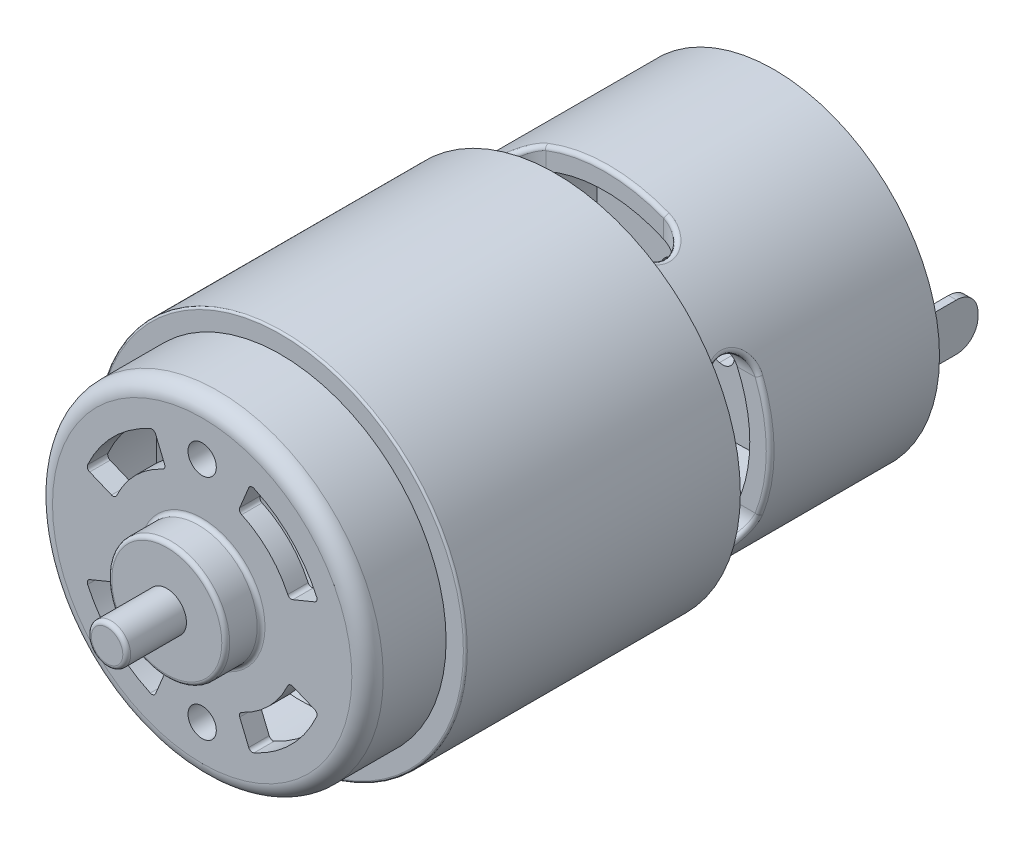
from build123d import *

# Parameters (mm, degrees)
SKETCH5_R                     = 21.05
MOTOR_BODY_DEPTH              = 71.3
SKETCH1_R                     = 23.5
FLUX_RING_DEPTH               = 35
SKETCH6_R                     = 7.5
FRONT_NUB_DEPTH               = 4.5
OUTPUT_SHAFT_DEPTH            = 12.1
OUTPUT_SHAFT_DEPTH_BACK       = 77.5
SKETCH3_R                     = 2.5
SKETCH16_R                    = 21.05
SKETCH16_R_2                  = 20.55
SHEET_METAL_CASING_EDGE_DEPTH = 1.5
SHELL1_START                  = -68.7
SHELL1_OUTLINE_R              = 18.45
SHELL1_DEPTH                  = 66.1
SHELL1_START_2                = -42.4
SHELL1_2_OUTLINE_R            = 20.9
SHELL1_2_OUTLINE_R_2          = 18.45
SHELL1_2_DEPTH                = 29.8
SHELL1_START_3                = -2.6
SHELL1_3_OUTLINE_R            = 4.9
SHELL1_3_DEPTH                = 4.5
M4_MOUNT_HOLES_REACH          = 86.325
SKETCH7_R                     = 1.8
CIRPATTERN1_COUNT             = 2
SIDE_VENT_HOLES_DEPTH         = 85.325263118
CIRPATTERN2_COUNT             = 4
FRONT_VENT_HOLES_REACH        = 86.325
CIRPATTERN3_COUNT             = 4
REAR_NUB_START                = 4.5
SKETCH10_R                    = 7.5
REAR_NUB_DEPTH                = 4.5
SKETCH11_R                    = 6.5
REAR_FLAIR_DEPTH              = 1
REAR_VENT_HOLES_REACH         = 91.778
MIRROR2_COPY_1_REACH          = 91.778
FILLET1_R                     = 0.5
FILLET3_R                     = 0.5
FILLET4_R                     = 2
FILLET5_R                     = 0.5
FILLET6_R                     = 0.25
SKETCH14_W                    = 4
SKETCH14_H                    = 10
PLASTIC_TERMINAL_BASE_DEPTH   = 1
SKETCH17_W                    = 1
SKETCH17_H                    = 6
BOSS_EXTRUDE14_DEPTH          = 7.5
FILLET7_R                     = 2.75


with BuildPart() as part:
    # Sketch5 → Motor_Body (new body)
    with BuildSketch(Plane.XY):
        Circle(SKETCH5_R)
    extrude(amount=-MOTOR_BODY_DEPTH)

    # Sketch1 → Flux_Ring (add)
    with BuildSketch(Plane.XY.offset(-10)):
        Circle(SKETCH1_R)
    extrude(amount=-FLUX_RING_DEPTH)

    # Sketch6 → Front_Nub (add)
    with BuildSketch(Plane.XY):
        Circle(SKETCH6_R)
    extrude(amount=FRONT_NUB_DEPTH)

    # Sketch3 → Output_Shaft (add, two sides: drawn at the far end of the back side and taken through both)
    with BuildSketch(Plane.XY.offset(-OUTPUT_SHAFT_DEPTH_BACK)):
        Circle(SKETCH3_R)
    extrude(amount=OUTPUT_SHAFT_DEPTH + OUTPUT_SHAFT_DEPTH_BACK)

    # Sketch16 → Sheet_Metal_Casing_Edge (add)
    with BuildSketch(Plane(origin=(0, 0, -71.3), x_dir=(-1, 0, 0), z_dir=(0, 0, -1))):
        with Locations(Location((0, 0, 0), (0, 0, 180))):
            Circle(SKETCH16_R)
        Circle(SKETCH16_R_2, mode=Mode.SUBTRACT)
    extrude(amount=SHEET_METAL_CASING_EDGE_DEPTH)

    # Shell1: read off the stored shape, not the designer's step
    # Shell1 outline → Shell1 (cut)
    with BuildSketch(Plane.XY.offset(SHELL1_START)):
        Circle(SHELL1_OUTLINE_R)
    extrude(amount=SHELL1_DEPTH, mode=Mode.SUBTRACT)

    # Shell1 2 outline → Shell1 2 (cut)
    with BuildSketch(Plane.XY.offset(SHELL1_START_2)):
        Circle(SHELL1_2_OUTLINE_R)
        Circle(SHELL1_2_OUTLINE_R_2, mode=Mode.SUBTRACT)
    extrude(amount=SHELL1_2_DEPTH, mode=Mode.SUBTRACT)

    # Shell1 3 outline → Shell1 3 (cut)
    with BuildSketch(Plane.XY.offset(SHELL1_START_3)):
        Circle(SHELL1_3_OUTLINE_R)
    extrude(amount=SHELL1_3_DEPTH, mode=Mode.SUBTRACT)

    # Sketch7 → m4_Mount_Holes (cut, up to next)
    with BuildSketch(Plane.XY, mode=Mode.PRIVATE) as m4_mount_holes_sk1:
        with Locations((0, 14.5)):
            Circle(SKETCH7_R)
    m4_mount_holes_tool1 = extrude(m4_mount_holes_sk1.sketch, amount=-M4_MOUNT_HOLES_REACH, mode=Mode.PRIVATE) & part.part
    m4_mount_holes = m4_mount_holes_tool1.solids().sort_by_distance((0, 14.5, 0))[0]
    add(m4_mount_holes, mode=Mode.SUBTRACT)

    # CirPattern1: m4_Mount_Holes ×2 about axis
    cirpattern1_axis = Axis((0, 0, 0), (0, 0, 1))
    for i in range(1, CIRPATTERN1_COUNT):
        add(m4_mount_holes.rotate(cirpattern1_axis, i * 360 / CIRPATTERN1_COUNT), mode=Mode.SUBTRACT)

    # Sketch8 → Side_Vent_Holes (cut, through all)
    with BuildSketch(Plane(origin=(0, 0, 0), x_dir=(1, 0, 0), z_dir=(0, 1, 0))):
        with BuildLine():
            Line((-7.5, 51.25), (7.5, 51.25))
            ThreePointArc((7.5, 51.25), (10.5, 48.25), (7.5, 45.25))
            Line((7.5, 45.25), (-7.5, 45.25))
            ThreePointArc((-7.5, 45.25), (-10.5, 48.25), (-7.5, 51.25))
        make_face()
    side_vent_holes = extrude(amount=SIDE_VENT_HOLES_DEPTH, mode=Mode.SUBTRACT)

    # CirPattern2: Side_Vent_Holes ×4 about axis
    cirpattern2_axis = Axis((0, 0, -92.225153379), (0, 0, 1))
    for i in range(1, CIRPATTERN2_COUNT):
        add(side_vent_holes.rotate(cirpattern2_axis, i * 360 / CIRPATTERN2_COUNT), mode=Mode.SUBTRACT)

    # Sketch9 → Front_Vent_Holes (cut, up to next)
    with BuildSketch(Plane.XY, mode=Mode.PRIVATE) as front_vent_holes_sk1:
        with BuildLine():
            Line((-4.592201188, 11.08655439), (-6.122934918, 14.78207252))
            ThreePointArc((-6.122934918, 14.78207252), (-11.313708499, 11.313708499), (-14.78207252, 6.122934918))
            Line((-14.78207252, 6.122934918), (-11.08655439, 4.592201188))
            ThreePointArc((-11.08655439, 4.592201188), (-8.485281374, 8.485281374), (-4.592201188, 11.08655439))
        make_face()
    front_vent_holes_tool1 = extrude(front_vent_holes_sk1.sketch, amount=-FRONT_VENT_HOLES_REACH, mode=Mode.PRIVATE) & part.part
    front_vent_holes = front_vent_holes_tool1.solids().sort_by_distance((-9.712638, 9.712638, 0))[0]
    add(front_vent_holes, mode=Mode.SUBTRACT)

    # CirPattern3: Front_Vent_Holes ×4 about axis
    cirpattern3_axis = Axis((0, 0, -92.225153379), (0, 0, 1))
    for i in range(1, CIRPATTERN3_COUNT):
        add(front_vent_holes.rotate(cirpattern3_axis, i * 360 / CIRPATTERN3_COUNT), mode=Mode.SUBTRACT)

    # Sketch10 → Rear_Nub (add)
    with BuildSketch(Plane(origin=(0, 0, -71.3), x_dir=(-1, 0, 0), z_dir=(0, 0, -1)).offset(REAR_NUB_START)):
        with Locations(Location((0, 0, 0), (0, 0, 180))):
            Circle(SKETCH10_R)
    extrude(amount=-REAR_NUB_DEPTH)

    # Sketch11 → Rear_Flair (add)
    with BuildSketch(Plane(origin=(0, 0, -75.8), x_dir=(-1, 0, 0), z_dir=(0, 0, -1))):
        Circle(SKETCH11_R)
    extrude(amount=REAR_FLAIR_DEPTH)

    # Sketch13 → Rear_Vent_Holes (cut, up to next)
    with BuildSketch(Plane(origin=(0, 0, -71.3), x_dir=(-1, 0, 0), z_dir=(0, 0, -1)), mode=Mode.PRIVATE) as rear_vent_holes_sk1:
        with BuildLine():
            ThreePointArc((-2.070552361, 7.72740661), (-5.274766521, 6.01471846), (-7.39103626, 3.061467459))
            ThreePointArc((-7.39103626, 3.061467459), (-9.350880707, 2.249673309), (-10.162674858, 4.209517756))
            ThreePointArc((-10.162674858, 4.209517756), (-7.252803966, 8.270237882), (-2.847009496, 10.625184089))
            ThreePointArc((-2.847009496, 10.625184089), (-1.009892189, 9.564523917), (-2.070552361, 7.72740661))
        make_face()
    rear_vent_holes_tool1 = extrude(rear_vent_holes_sk1.sketch, amount=-REAR_VENT_HOLES_REACH, mode=Mode.PRIVATE) & part.part
    rear_vent_holes = rear_vent_holes_tool1.solids().sort_by_distance((5.955533, 6.790984, -71.3))[0]
    add(rear_vent_holes, mode=Mode.SUBTRACT)

    # Mirror1: Rear_Vent_Holes across plane
    add(rear_vent_holes.mirror(Plane(origin=(0, 0, 0), x_dir=(0, 0, 1), z_dir=(1, 0, 0))), mode=Mode.SUBTRACT)

    # Mirror2: Rear_Vent_Holes across plane
    add(rear_vent_holes.mirror(Plane.ZX), mode=Mode.SUBTRACT)

    # Mirror2 copy 1 sketch → Mirror2 copy 1 (cut, up to next)
    with BuildSketch(Plane(origin=(0, 0, -71.3), x_dir=(1, 0, 0), z_dir=(0, 0, -1)), mode=Mode.PRIVATE) as mirror2_copy_1_sk1:
        with BuildLine():
            ThreePointArc((-2.070552361, 7.72740661), (-5.274766521, 6.01471846), (-7.39103626, 3.061467459))
            ThreePointArc((-7.39103626, 3.061467459), (-9.350880707, 2.249673309), (-10.162674858, 4.209517756))
            ThreePointArc((-10.162674858, 4.209517756), (-7.252803966, 8.270237882), (-2.847009496, 10.625184089))
            ThreePointArc((-2.847009496, 10.625184089), (-1.009892189, 9.564523917), (-2.070552361, 7.72740661))
        make_face()
    mirror2_copy_1_tool1 = extrude(mirror2_copy_1_sk1.sketch, amount=-MIRROR2_COPY_1_REACH, mode=Mode.PRIVATE) & part.part
    add(mirror2_copy_1_tool1.solids().sort_by_distance((-5.955533, -6.790984, -71.3))[0], mode=Mode.SUBTRACT)

    # Fillet1
    fillet1_edges = [part.edges().sort_by_distance(p)[0] for p in [
        (-4.592201188, 11.08655439, -1.3),
        (-11.08655439, 4.592201188, -1.3),
        (-14.78207252, 6.122934918, -1.3),
        (-6.122934918, 14.78207252, -1.3),
        (-11.08655439, -4.592201188, -1.3),
        (-4.592201188, -11.08655439, -1.3),
        (-6.122934918, -14.78207252, -1.3),
        (-14.78207252, -6.122934918, -1.3),
        (4.592201188, -11.08655439, -1.3),
        (11.08655439, -4.592201188, -1.3),
        (14.78207252, -6.122934918, -1.3),
        (6.122934918, -14.78207252, -1.3),
        (11.08655439, 4.592201188, -1.3),
        (4.592201188, 11.08655439, -1.3),
        (6.122934918, 14.78207252, -1.3),
        (14.78207252, 6.122934918, -1.3),
    ]]
    fillet(fillet1_edges, radius=FILLET1_R)

    # Fillet2: read off the stored shape, not the designer's step
    # Fillet2 outline → Fillet2 (revolve, cut)
    with BuildSketch(Plane.XZ):
        with BuildLine():
            Line((7.5, -76.8), (7.5, -75.3))
            ThreePointArc((7.5, -75.3), (7.353553391, -75.653553391), (7, -75.8))
            Line((7, -75.8), (7, -76.8))
            Line((7, -76.8), (7.5, -76.8))
        make_face()
        with BuildLine():
            ThreePointArc((7, 4.5), (7.353553391, 4.353553391), (7.5, 4))
            Line((7.5, 4), (7.5, 4.5))
            Line((7.5, 4.5), (7, 4.5))
        make_face()
    revolve(axis=Axis((0, 0, 0), (0, 0, 1)), mode=Mode.SUBTRACT)

    # Fillet2 2 outline → Fillet2 2 (revolve)
    with BuildSketch(Plane.XZ):
        with BuildLine():
            ThreePointArc((7.5, -71.8), (7.646446609, -71.446446609), (8, -71.3))
            Line((8, -71.3), (7.5, -71.3))
            Line((7.5, -71.3), (7.5, -71.8))
        make_face()
        with BuildLine():
            Line((7.5, 0), (8, 0))
            ThreePointArc((8, 0), (7.646446609, 0.146446609), (7.5, 0.5))
            Line((7.5, 0.5), (7.5, 0))
        make_face()
        with BuildLine():
            Line((7, -75.8), (7, -75.3))
            Line((7, -75.3), (6, -75.3))
            Line((6, -75.3), (6, -76.8))
            ThreePointArc((6, -76.8), (6.353553391, -76.653553391), (6.5, -76.3))
            ThreePointArc((6.5, -76.3), (6.646446609, -75.946446609), (7, -75.8))
        make_face()
    revolve(axis=Axis((0, 0, 0), (0, 0, 1)))

    # Fillet2 3 outline → Fillet2 3 (revolve, cut)
    with BuildSketch(Plane.XZ):
        with BuildLine():
            Line((6.5, -76.8), (6.5, -76.3))
            ThreePointArc((6.5, -76.3), (6.353553391, -76.653553391), (6, -76.8))
            Line((6, -76.8), (6.5, -76.8))
        make_face()
    revolve(axis=Axis((0, 0, 0), (0, 0, 1)), mode=Mode.SUBTRACT)

    # Fillet3
    fillet3_edges = [part.edges().sort_by_distance(p)[0] for p in [
        (-2.5, 0, -77.5),
        (-2.5, 0, 12.1),
    ]]
    fillet(fillet3_edges, radius=FILLET3_R)

    # Fillet4
    fillet4_edges = [part.edges().sort_by_distance(p)[0] for p in [
        (-21.05, 0, 0),
    ]]
    fillet(fillet4_edges, radius=FILLET4_R)

    # Fillet5
    fillet5_edges = [part.edges().sort_by_distance(p)[0] for p in [
        (0, 21.05, -51.25),
        (20.701761042, 3.813081401, -51.25),
        (20.701761042, 3.813081401, -51.25),
        (0, -21.05, -51.25),
        (-21.05, 0, -51.25),
    ]]
    fillet(fillet5_edges, radius=FILLET5_R)

    # Fillet6
    fillet6_edges = [part.edges().sort_by_distance(p)[0] for p in [
        (-23.5, 0, -10),
    ]]
    fillet(fillet6_edges, radius=FILLET6_R)

    # Sketch14 → Plastic_Terminal_Base (add)
    with BuildSketch(Plane(origin=(0, 0, -71.3), x_dir=(-1, 0, 0), z_dir=(0, 0, -1))):
        with Locations((-18.447554866, 0)):
            Rectangle(SKETCH14_W, SKETCH14_H)
        with Locations((18.447554866, 0)):
            Rectangle(SKETCH14_W, SKETCH14_H)
    extrude(amount=PLASTIC_TERMINAL_BASE_DEPTH)

    # Sketch17 → Boss-Extrude14 (add)
    with BuildSketch(Plane(origin=(0, 0, -72.3), x_dir=(-1, 0, 0), z_dir=(0, 0, -1))):
        with Locations((-18.447554866, 0)):
            Rectangle(SKETCH17_W, SKETCH17_H)
        with Locations((18.447554866, 0)):
            Rectangle(SKETCH17_W, SKETCH17_H)
    extrude(amount=BOSS_EXTRUDE14_DEPTH)

    # Fillet7
    fillet7_edges = [part.edges().sort_by_distance(p)[0] for p in [
        (18.447554866, 3, -79.8),
        (18.447554866, -3, -79.8),
        (-18.447554866, 3, -79.8),
        (-18.447554866, -3, -79.8),
    ]]
    fillet(fillet7_edges, radius=FILLET7_R)


solid = part.part
